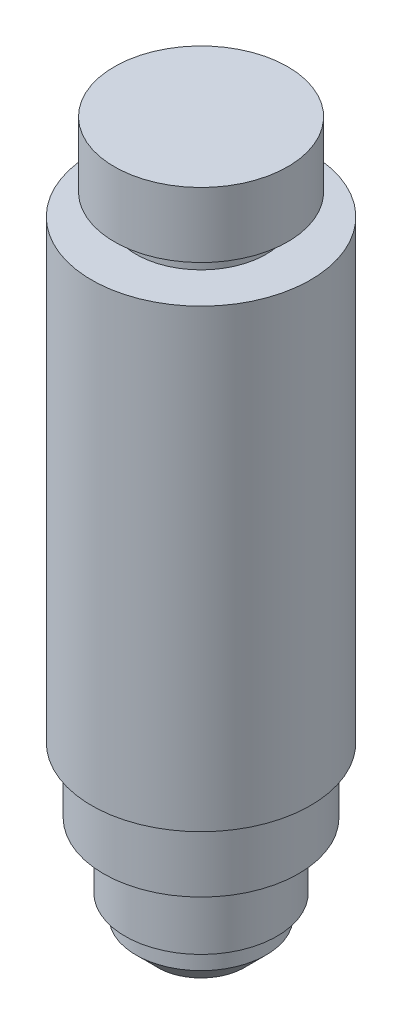
from build123d import *

# Parameters (mm, degrees)
CHAMFER1_SIZE = 2.54


with BuildPart() as part:
    # Sketch1 → Revolve1 (revolve)
    with BuildSketch(Plane.XY, mode=Mode.PRIVATE) as revolve1_sk:
        Polygon((12.827, 73.66), (12.827, 20.32), (11.43, 20.32), (11.43, 12.7), (7.62, 12.7), (7.62, 11.43), (8.89, 11.43), (8.89, 5.08), (7.62, 5.08), (7.62, 2.54), (5.08, 2.54), (5.08, 0), (0, 0), (0, 83.82), (10.16, 83.82), (10.16, 76.2), (7.62, 76.2), (7.62, 73.66), align=None)
    revolve(revolve1_sk.sketch.rotate(Axis((0, 0, 0), (0, 1, 0)), 90), axis=Axis((0, 0, 0), (0, 1, 0)))

    # Chamfer1
    chamfer1_edges = [part.edges().sort_by_distance(p)[0] for p in [
        (0, 2.54, 5.08),
    ]]
    chamfer(chamfer1_edges, length=CHAMFER1_SIZE - 0.0001)  # a hair under: the kernel refuses the full size


solid = part.part
